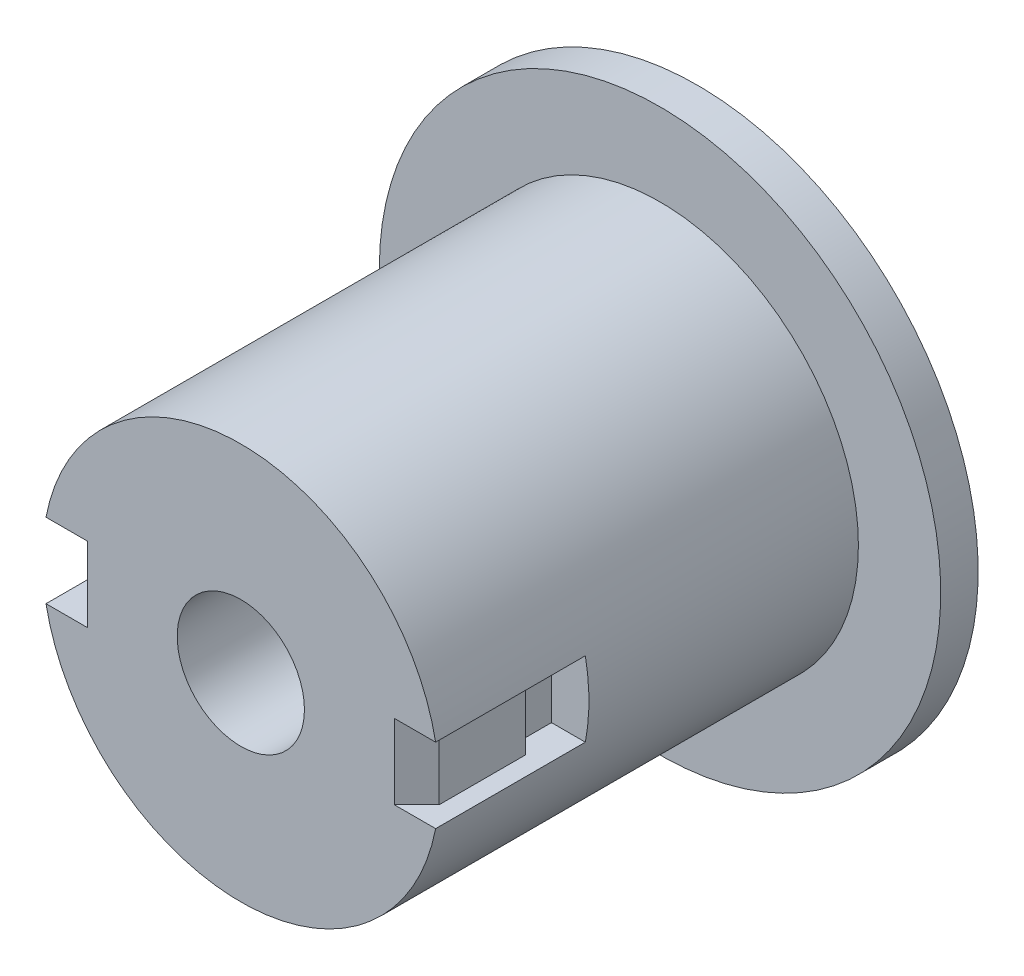
from build123d import *

# Parameters (mm, degrees)
SKETCH1_R           = 26.5
BOSS_EXTRUDE1_DEPTH = 56
SKETCH4_R           = 37.5
BOSS_EXTRUDE2_DEPTH = 5
SKETCH5_R           = 8.5
CUT_EXTRUDE1_DEPTH  = 81.830068663
CUT_EXTRUDE2_DEPTH  = 5


with BuildPart() as part:
    # Sketch1 → Boss-Extrude1 (new body)
    with BuildSketch(Plane.XY):
        Circle(SKETCH1_R)
    extrude(amount=BOSS_EXTRUDE1_DEPTH)

    # Sketch4 → Boss-Extrude2 (add)
    with BuildSketch(Plane(origin=(0, 0, 0), x_dir=(-1, 0, 0), z_dir=(0, 0, -1))):
        Circle(SKETCH4_R)
    extrude(amount=BOSS_EXTRUDE2_DEPTH)

    # Sketch5 → Cut-Extrude1 (cut, through all)
    with BuildSketch(Plane.XY.offset(56)):
        Circle(SKETCH5_R)
    extrude(amount=-CUT_EXTRUDE1_DEPTH, mode=Mode.SUBTRACT)

    # Sketch6 → Cut-Extrude2 (cut, symmetric)
    with BuildSketch(Plane(origin=(0, 0, 0), x_dir=(1, 0, 0), z_dir=(0, 1, 0))):
        Polygon((23.5, -56), (26.5, -56), (26.5, -36), (21.5, -36), (21.5, -39.5), (23.5, -41.5), (23.5, -53), (20.5, -56), align=None)
    cut_extrude2 = extrude(amount=CUT_EXTRUDE2_DEPTH, both=True, mode=Mode.SUBTRACT)

    # Mirror1: Cut-Extrude2 across plane
    add(cut_extrude2.mirror(Plane(origin=(0, 0, 0), x_dir=(0, 0, 1), z_dir=(1, 0, 0))), mode=Mode.SUBTRACT)


solid = part.part
